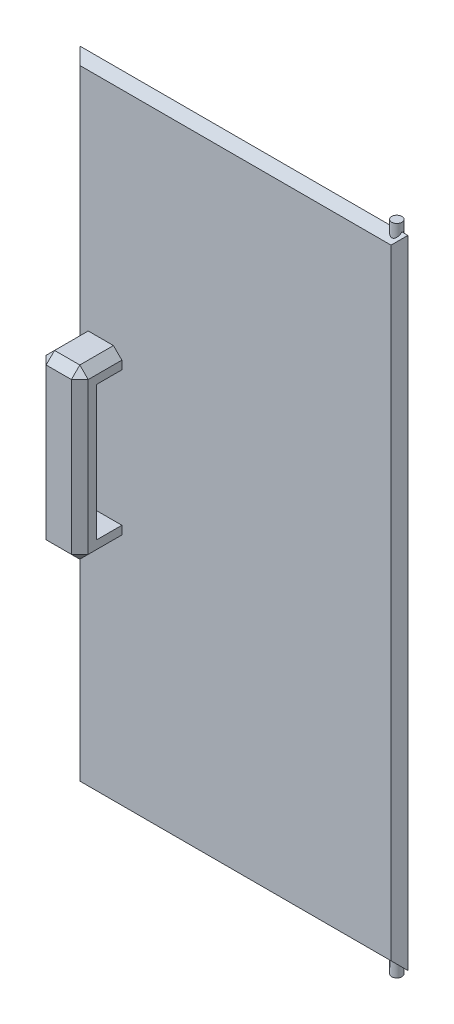
from build123d import *

# Parameters (mm, degrees)
SKETCH1_W           = 390
SKETCH1_H           = 756.8
BOSS_EXTRUDE1_DEPTH = 20
SKETCH2_R           = 6.05
BOSS_EXTRUDE2_DEPTH = 10
BOSS_EXTRUDE3_START = 10
SKETCH3_R           = 6.05
BOSS_EXTRUDE3_DEPTH = 10
CHAMFER1_SIZE       = 10
BOSS_EXTRUDE4_DEPTH = 50
SKETCH5_W           = 30
SKETCH5_H           = 160
CUT_EXTRUDE1_DEPTH  = 131
CHAMFER2_SIZE       = 10


with BuildPart() as part:
    # Sketch1 → Boss-Extrude1 (new body)
    with BuildSketch(Plane.XY):
        with Locations((147.890593688, -358.84384058)):
            Rectangle(SKETCH1_W, SKETCH1_H)
    extrude(amount=BOSS_EXTRUDE1_DEPTH)

    # Sketch2 → Boss-Extrude2 (add)
    with BuildSketch(Plane(origin=(0, 19.55615942, 0), x_dir=(1, 0, 0), z_dir=(0, 1, 0))):
        with Locations(Location((329.77827945, -10, 0), (0, 0, 90))):
            Circle(SKETCH2_R)
    extrude(amount=BOSS_EXTRUDE2_DEPTH)

    # Sketch3 → Boss-Extrude3 (add)
    with BuildSketch(Plane.XZ.offset(737.24384058).offset(BOSS_EXTRUDE3_START)):
        with Locations(Location((329.77827945, 10, 0), (0, 0, 270))):
            Circle(SKETCH3_R)
    extrude(amount=-BOSS_EXTRUDE3_DEPTH)

    # Chamfer1
    # the kernel refuses this chamfer: 10 mm, written as the material it takes off along each edge
    with BuildSketch(Plane(origin=(368.607423567, -737.24384058, 0), x_dir=(0, 0.9996219169112968, -0.027495876610586487), z_dir=(-1, 0, 0))) as chamfer1_piece_1_section:
        Polygon((CHAMFER1_SIZE * 0.999621916911, -CHAMFER1_SIZE * 0.0274958766106), (-CHAMFER1_SIZE * 0.0274958766106, -CHAMFER1_SIZE * 0.999621916911), (0, 0), align=None)
    chamfer1_piece_1 = extrude(amount=441.433659759, mode=Mode.PRIVATE)
    chamfer1_piece_1 = chamfer1_piece_1 - Plane(origin=(329.77827945, -733.933944157, 10), x_dir=(0, 0, -1), z_dir=(0, -1, 0)) * Cylinder(6.05, 923, mode=Mode.PRIVATE)
    add(chamfer1_piece_1, mode=Mode.SUBTRACT)
    with BuildSketch(Plane(origin=(-47.109406312, -762.960670459, 0), x_dir=(-0.027495876610586317, 0, 0.9996219169112968), z_dir=(0, 1, 0)), Plane(origin=(342.890593688, 45.2729893, 20), x_dir=(-0.9996219169112968, 0, 0.027495876610586282), z_dir=(0, -1, 0))) as chamfer1_piece_2:
        Polygon((CHAMFER1_SIZE * 0.999621916911, CHAMFER1_SIZE * 0.0274958766106), (-CHAMFER1_SIZE * 0.0274958766106, CHAMFER1_SIZE * 0.999621916911), (0, 0), align=None)
    extrude(amount=808.233659759, mode=Mode.SUBTRACT)
    with BuildSketch(Plane(origin=(-72.826236192, 19.55615942, 0), x_dir=(0, 0.027495876610586317, 0.9996219169112968), z_dir=(1, 0, 0))) as chamfer1_piece_3_section:
        Polygon((CHAMFER1_SIZE * 0.999621916911, CHAMFER1_SIZE * 0.0274958766106), (-CHAMFER1_SIZE * 0.0274958766106, CHAMFER1_SIZE * 0.999621916911), (0, 0), align=None)
    chamfer1_piece_3 = extrude(amount=441.433659759, mode=Mode.PRIVATE)
    chamfer1_piece_3 = chamfer1_piece_3 - Plane(origin=(329.77827945, 16.24626296, 10), x_dir=(0, 0, -1), z_dir=(0, -1, 0)) * Cylinder(6.05, 923, mode=Mode.PRIVATE)
    add(chamfer1_piece_3, mode=Mode.SUBTRACT)
    with BuildSketch(Plane(origin=(342.890593688, 45.2729893, 0), x_dir=(-0.9996219169112968, 0, -0.027495876610586334), z_dir=(0, -1, 0)), Plane(origin=(-47.109406312, -762.960670459, 20), x_dir=(-0.027495876610586317, 0, -0.9996219169112968), z_dir=(0, 1, 0))) as chamfer1_piece_4:
        Polygon((CHAMFER1_SIZE * 0.999621916911, -CHAMFER1_SIZE * 0.0274958766106), (-CHAMFER1_SIZE * 0.0274958766106, -CHAMFER1_SIZE * 0.999621916911), (0, 0), align=None)
    extrude(amount=808.233659759, mode=Mode.SUBTRACT)
    with BuildSketch(Plane(origin=(368.607423567, -737.24384058, 20), x_dir=(0, 0.9996219169112968, 0.02749587661058643), z_dir=(-1, 0, 0))) as chamfer1_piece_5_section:
        Polygon((CHAMFER1_SIZE * 0.999621916911, CHAMFER1_SIZE * 0.0274958766106), (-CHAMFER1_SIZE * 0.0274958766106, CHAMFER1_SIZE * 0.999621916911), (0, 0), align=None)
    chamfer1_piece_5 = extrude(amount=441.433659759, mode=Mode.PRIVATE)
    chamfer1_piece_5 = chamfer1_piece_5 - Plane(origin=(329.77827945, -733.933944133, 10), x_dir=(0, 0, -1), z_dir=(0, -1, 0)) * Cylinder(6.05, 923, mode=Mode.PRIVATE)
    add(chamfer1_piece_5, mode=Mode.SUBTRACT)
    with BuildSketch(Plane(origin=(-72.826236192, 19.55615942, 20), x_dir=(0, 0.027495876610586317, -0.9996219169112968), z_dir=(1, 0, 0))) as chamfer1_piece_6_section:
        Polygon((CHAMFER1_SIZE * 0.999621916911, -CHAMFER1_SIZE * 0.0274958766106), (-CHAMFER1_SIZE * 0.0274958766106, -CHAMFER1_SIZE * 0.999621916911), (0, 0), align=None)
    chamfer1_piece_6 = extrude(amount=441.433659759, mode=Mode.PRIVATE)
    chamfer1_piece_6 = chamfer1_piece_6 - Plane(origin=(329.77827945, 16.246262993, 10), x_dir=(0, 0, -1), z_dir=(0, -1, 0)) * Cylinder(6.05, 923, mode=Mode.PRIVATE)
    add(chamfer1_piece_6, mode=Mode.SUBTRACT)

    # Sketch4 → Boss-Extrude4 (add)
    with BuildSketch(Plane.XY.offset(20)):
        Polygon((12.890593688, -358.84384058), (12.890593688, -258.84384058), (-37.109406312, -258.84384058), (-37.109406312, -458.84384058), (12.890593688, -458.84384058), align=None)
    extrude(amount=BOSS_EXTRUDE4_DEPTH)

    # Sketch5 → Cut-Extrude1 (cut)
    with BuildSketch(Plane.ZY.offset(37.109406312)):
        with Locations((35, -358.84384058)):
            Rectangle(SKETCH5_W, SKETCH5_H)
    extrude(amount=-CUT_EXTRUDE1_DEPTH, mode=Mode.SUBTRACT)

    # Chamfer2
    chamfer2_edges = [part.edges().sort_by_distance(p)[0] for p in [
        (-37.109406312, -458.84384058, 45),
        (12.890593688, -458.84384058, 45),
        (12.890593688, -258.84384058, 45),
        (-37.109406312, -258.84384058, 45),
        (-12.109406312, -458.84384058, 70),
        (12.890593688, -358.84384058, 70),
        (-12.109406312, -258.84384058, 70),
        (-37.109406312, -358.84384058, 70),
    ]]
    chamfer(chamfer2_edges, length=CHAMFER2_SIZE)


solid = part.part
